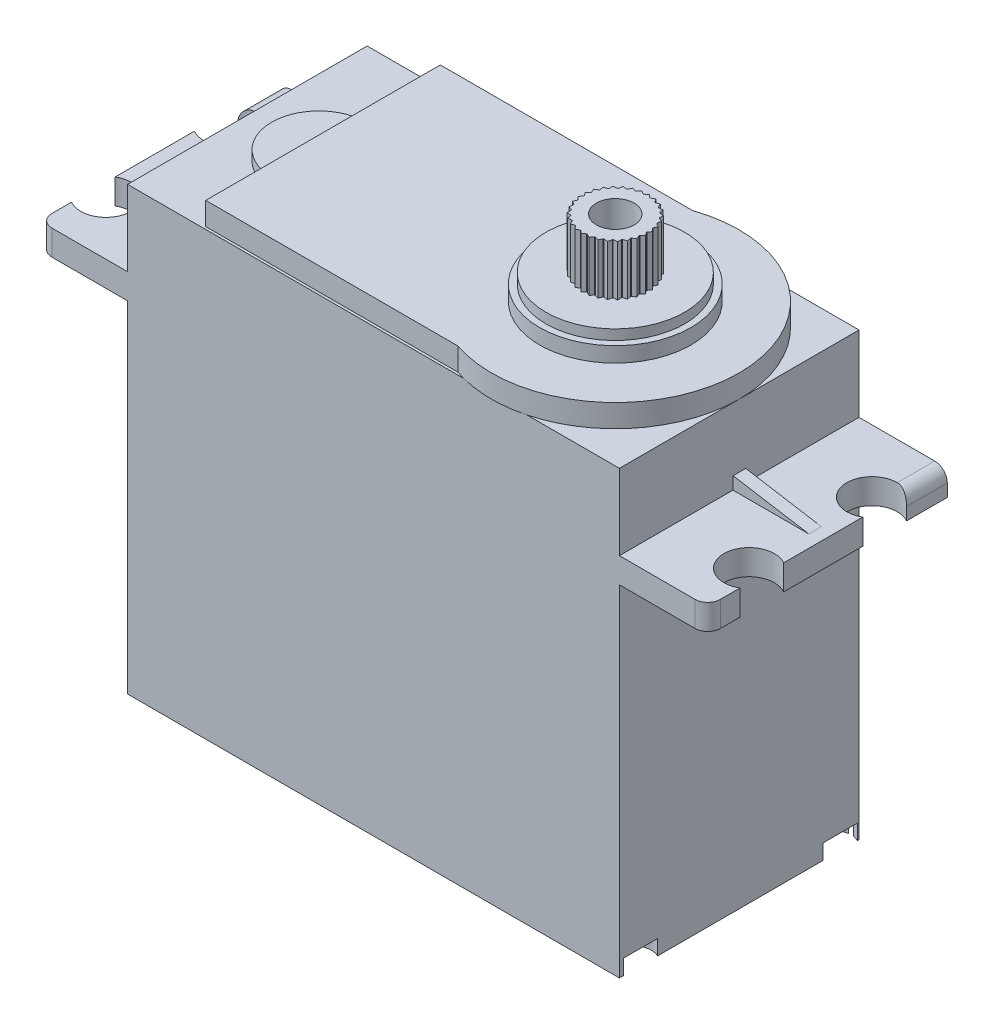
from build123d import *

# Parameters (mm, degrees)
SKETCH1_W           = 39
SKETCH1_H           = 35
BOSS_EXTRUDE1_DEPTH = 19
SKETCH2_W           = 7
SKETCH2_H           = 2
BOSS_EXTRUDE2_DEPTH = 19
BOSS_EXTRUDE3_DEPTH = 0.5
SKETCH4_R           = 2
CUT_EXTRUDE1_DEPTH  = 3
FILLET1_R           = 1
BOSS_EXTRUDE4_DEPTH = 1.8
SKETCH6_R           = 1.5
CUT_EXTRUDE2_DEPTH  = 1.2
SKETCH7_R           = 6
BOSS_EXTRUDE5_DEPTH = 1.2
SKETCH8_R           = 5.5
BOSS_EXTRUDE6_DEPTH = 0.8
BOSS_EXTRUDE7_DEPTH = 0.8
SKETCH10_R          = 2.5
BOSS_EXTRUDE8_DEPTH = 4
BOSS_EXTRUDE9_DEPTH = 4
CIRPATTERN2_COUNT   = 30
SKETCH12_R          = 1.5
CUT_EXTRUDE4_DEPTH  = 4


with BuildPart() as part:
    # Sketch1 → Boss-Extrude1 (new body)
    with BuildSketch(Plane.XY):
        with Locations((-4.183412042, -9.229571984)):
            Rectangle(SKETCH1_W, SKETCH1_H)
    extrude(amount=BOSS_EXTRUDE1_DEPTH)

    # Sketch2 → Boss-Extrude2 (add)
    with BuildSketch(Plane.XY.offset(19)):
        with Locations((18.816587958, 1.270428016)):
            Rectangle(SKETCH2_W, SKETCH2_H)
        with Locations((-27.183412042, 1.270428016)):
            Rectangle(SKETCH2_W, SKETCH2_H)
    extrude(amount=-BOSS_EXTRUDE2_DEPTH)

    # Sketch3 → Boss-Extrude3 (add, symmetric)
    with BuildSketch(Plane.XY.offset(9.5)):
        Polygon((15.333582704, 3.272295291), (15.333582704, 2.272295291), (21.333582704, 2.272295291), align=None)
        Polygon((-29.666485395, 2.272295291), (-23.666485395, 3.272295291), (-23.666485395, 2.272295291), align=None)
    extrude(amount=BOSS_EXTRUDE3_DEPTH, both=True)


with BuildPart() as boss_extrude3_piece_1:
    # of the separate pieces the step leaves, piece 1, a body of its own (boss_extrude3_pieces)
    add(part.part.solids().sort_by_distance((-23.683412042, 8.270428016, 0))[0])

    # Sketch4 → Cut-Extrude1 (cut)
    with BuildSketch(Plane(origin=(0, 2.270428016, 0), x_dir=(1, 0, 0), z_dir=(0, 1, 0))):
        with Locations((21.316587958, -14.710690781)):
            Circle(SKETCH4_R)
        with Locations((21.316587958, -4.967002747)):
            Circle(SKETCH4_R)
        with Locations((-29.683412042, -14.710690781)):
            Circle(SKETCH4_R)
        with Locations((-29.683412042, -4.967002747)):
            Circle(SKETCH4_R)
    extrude(amount=-CUT_EXTRUDE1_DEPTH, mode=Mode.SUBTRACT)

    # Fillet1
    fillet1_edges = [boss_extrude3_piece_1.edges().sort_by_distance(p)[0] for p in [
        (-30.683412042, 1.270428016, 19),
        (-30.683412042, 2.270428016, 1.61747597),
        (22.316587958, 2.270428016, 1.61747597),
        (22.316587958, 1.270428016, 19),
    ]]
    fillet(fillet1_edges, radius=FILLET1_R)

    # Sketch5 → Boss-Extrude4 (add)
    with BuildSketch(Plane(origin=(0, 8.270428016, 0), x_dir=(1, 0, 0), z_dir=(0, 1, 0))):
        with BuildLine():
            Line((-17.683412042, -0.2), (-17.683412042, -18.8))
            Line((-17.683412042, -18.8), (2.316587958, -18.8))
            ThreePointArc((2.316587958, -18.8), (15.316587958, -9.5), (2.316587958, -0.2))
            Line((2.316587958, -0.2), (-17.683412042, -0.2))
        make_face()
    extrude(amount=BOSS_EXTRUDE4_DEPTH)

    # Sketch6 → Cut-Extrude2 (cut)
    with BuildSketch(Plane.XZ.offset(26.729571984)):
        with Locations((-22.660585011, 17.329722527)):
            Circle(SKETCH6_R)
        with Locations((-22.660585011, 1.487126069)):
            Circle(SKETCH6_R)
        with Locations((14.670467636, 17.329722527)):
            Circle(SKETCH6_R)
        with Locations((14.670467636, 1.487126069)):
            Circle(SKETCH6_R)
    extrude(amount=-CUT_EXTRUDE2_DEPTH, mode=Mode.SUBTRACT)

    # Sketch7 → Boss-Extrude5 (add)
    with BuildSketch(Plane(origin=(0, 10.070428016, 0), x_dir=(1, 0, 0), z_dir=(0, 1, 0))):
        with Locations((5.490049496, -9.5)):
            Circle(SKETCH7_R)
    extrude(amount=BOSS_EXTRUDE5_DEPTH)

    # Sketch8 → Boss-Extrude6 (add)
    with BuildSketch(Plane(origin=(0, 11.270428016, 0), x_dir=(1, 0, 0), z_dir=(0, 1, 0))):
        with Locations((5.490049496, -9.5)):
            Circle(SKETCH8_R)
    extrude(amount=BOSS_EXTRUDE6_DEPTH)

    # Sketch9 → Boss-Extrude7 (add)
    with BuildSketch(Plane(origin=(0, 8.270428016, 0), x_dir=(1, 0, 0), z_dir=(0, 1, 0))):
        with BuildLine():
            Line((-17.683412042, -6.065911172), (-17.683412042, -13.575118742))
            ThreePointArc((-17.683412042, -13.575118742), (-21.438015827, -9.820514957), (-17.683412042, -6.065911172))
        make_face()
    extrude(amount=BOSS_EXTRUDE7_DEPTH)

    # Sketch10 → Boss-Extrude8 (add)
    with BuildSketch(Plane(origin=(0, 12.070428016, 0), x_dir=(1, 0, 0), z_dir=(0, 1, 0))):
        with Locations((5.490049496, -9.5)):
            Circle(SKETCH10_R)
    extrude(amount=BOSS_EXTRUDE8_DEPTH)

    # Sketch11 → Boss-Extrude9 (add)
    with BuildSketch(Plane(origin=(0, 16.070428016, 0), x_dir=(1, 0, 0), z_dir=(0, 1, 0))):
        Polygon((5.503448723, -6.801928291), (5.263137454, -7.010319112), (5.736737319, -7.012200748), align=None)
    boss_extrude9 = extrude(amount=-BOSS_EXTRUDE9_DEPTH)

    # CirPattern2: Boss-Extrude9 ×30 about axis
    cirpattern2_axis = Axis((5.490049496, 16.070428016, 9.5), (0, 1, 0))
    for i in range(1, CIRPATTERN2_COUNT):
        add(boss_extrude9.rotate(cirpattern2_axis, i * 360 / CIRPATTERN2_COUNT))

    # Sketch12 → Cut-Extrude4 (cut)
    with BuildSketch(Plane(origin=(0, 16.070428016, 0), x_dir=(1, 0, 0), z_dir=(0, 1, 0))):
        with Locations((5.490049496, -9.5)):
            Circle(SKETCH12_R)
    extrude(amount=-CUT_EXTRUDE4_DEPTH, mode=Mode.SUBTRACT)


with BuildPart() as boss_extrude3_piece_2:
    # of the separate pieces the step leaves, piece 2, a body of its own (boss_extrude3_pieces)
    add(part.part.solids().sort_by_distance((15.333582704, 3.272295291, 9))[0])


solid = Compound([boss_extrude3_piece_1.part, boss_extrude3_piece_2.part])
